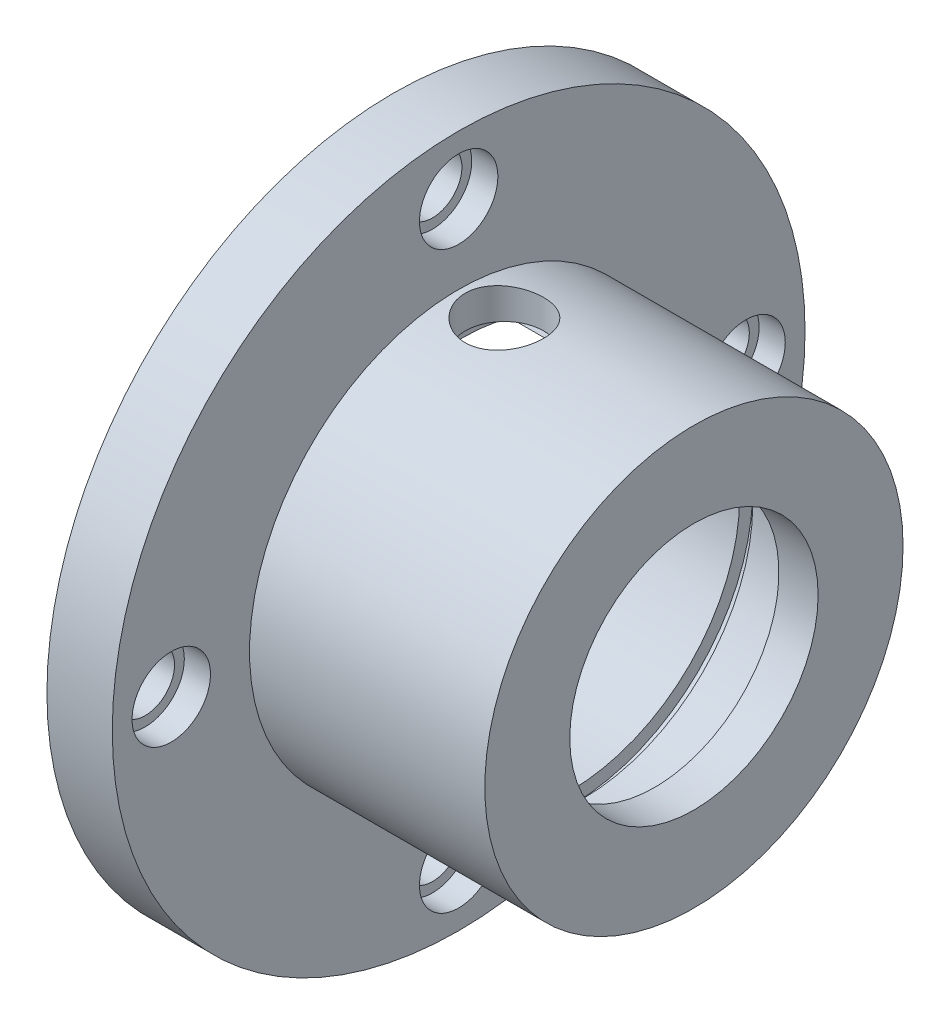
from build123d import *

# Parameters (mm, degrees)
SKETCH1_R           = 26.5
SKETCH1_R_2         = 2.25
BOSS_EXTRUDE1_DEPTH = 11.5
CUT_EXTRUDE1_START  = -18
SKETCH2_R           = 26.5
SKETCH2_R_2         = 2.25
SKETCH2_R_3         = 16
CUT_EXTRUDE1_DEPTH  = 18
SKETCH3_R           = 13
CUT_EXTRUDE2_DEPTH  = 20
SKETCH4_R           = 9.5
CUT_EXTRUDE3_DEPTH  = 20
SKETCH5_R           = 14
CUT_EXTRUDE4_DEPTH  = 0.5
SKETCH6_R           = 3
CUT_EXTRUDE5_DEPTH  = 33
SKETCH8_W           = 6.282269922
SKETCH8_H           = 12
CUT_EXTRUDE6_DEPTH  = 1
SKETCH9_R           = 3
CUT_EXTRUDE7_DEPTH  = 2


with BuildPart() as part:
    # Sketch1 → Boss-Extrude1 (new, symmetric)
    with BuildSketch(Plane(origin=(0, 0, 0), x_dir=(0, 0, -1), z_dir=(1, 0, 0))):
        Circle(SKETCH1_R)
        with Locations((0, -21.987670406)):
            Circle(SKETCH1_R_2, mode=Mode.SUBTRACT)
        with Locations((-21.987670406, 0)):
            Circle(SKETCH1_R_2, mode=Mode.SUBTRACT)
        with Locations((0, 21.987670406)):
            Circle(SKETCH1_R_2, mode=Mode.SUBTRACT)
        with Locations((21.987670406, 0)):
            Circle(SKETCH1_R_2, mode=Mode.SUBTRACT)
    extrude(amount=BOSS_EXTRUDE1_DEPTH, both=True)

    # Sketch2 → Cut-Extrude1 (cut)
    with BuildSketch(Plane(origin=(11.5, 0, 0), x_dir=(0, 0, -1), z_dir=(1, 0, 0)).offset(CUT_EXTRUDE1_START)):
        Circle(SKETCH2_R)
        with Locations((0, -21.987670406)):
            Circle(SKETCH2_R_2, mode=Mode.SUBTRACT)
        with Locations((-21.987670406, 0)):
            Circle(SKETCH2_R_2, mode=Mode.SUBTRACT)
        with Locations((0, 21.987670406)):
            Circle(SKETCH2_R_2, mode=Mode.SUBTRACT)
        Circle(SKETCH2_R_3, mode=Mode.SUBTRACT)
        with Locations((21.987670406, 0)):
            Circle(SKETCH2_R_2, mode=Mode.SUBTRACT)
    extrude(amount=CUT_EXTRUDE1_DEPTH, mode=Mode.SUBTRACT)

    # Sketch3 → Cut-Extrude2 (cut)
    with BuildSketch(Plane.ZY.offset(11.5)):
        Circle(SKETCH3_R)
    extrude(amount=-CUT_EXTRUDE2_DEPTH, mode=Mode.SUBTRACT)

    # Sketch4 → Cut-Extrude3 (cut)
    with BuildSketch(Plane.ZY.offset(-8.5)):
        Circle(SKETCH4_R)
    extrude(amount=-CUT_EXTRUDE3_DEPTH, mode=Mode.SUBTRACT)

    # Sketch5 → Cut-Extrude4 (cut, symmetric)
    with BuildSketch(Plane.ZY.offset(-2.5)):
        Circle(SKETCH5_R)
    extrude(amount=CUT_EXTRUDE4_DEPTH, both=True, mode=Mode.SUBTRACT)

    # Sketch6 → Cut-Extrude5 (cut)
    with BuildSketch(Plane(origin=(0, 0, 0), x_dir=(1, 0, 0), z_dir=(0, 1, 0))):
        with Locations((-3, 0)):
            Circle(SKETCH6_R)
    extrude(amount=CUT_EXTRUDE5_DEPTH, mode=Mode.SUBTRACT)

    # Sketch8 → Cut-Extrude6 (cut)
    with BuildSketch(Plane(origin=(0, 13.5, 0), x_dir=(1, 0, 0), z_dir=(0, 1, 0))):
        with Locations((-3, 0)):
            Rectangle(SKETCH8_W, SKETCH8_H)
    extrude(amount=-CUT_EXTRUDE6_DEPTH, mode=Mode.SUBTRACT)

    # Sketch9 → Cut-Extrude7 (cut)
    with BuildSketch(Plane(origin=(-6.5, 0, 0), x_dir=(0, 0, -1), z_dir=(1, 0, 0))):
        with Locations((0, 21.987670406)):
            Circle(SKETCH9_R)
        with Locations((21.987670406, 0)):
            Circle(SKETCH9_R)
        with Locations((0, -21.987670406)):
            Circle(SKETCH9_R)
        with Locations((-21.987670406, 0)):
            Circle(SKETCH9_R)
    extrude(amount=-CUT_EXTRUDE7_DEPTH, mode=Mode.SUBTRACT)


solid = part.part
